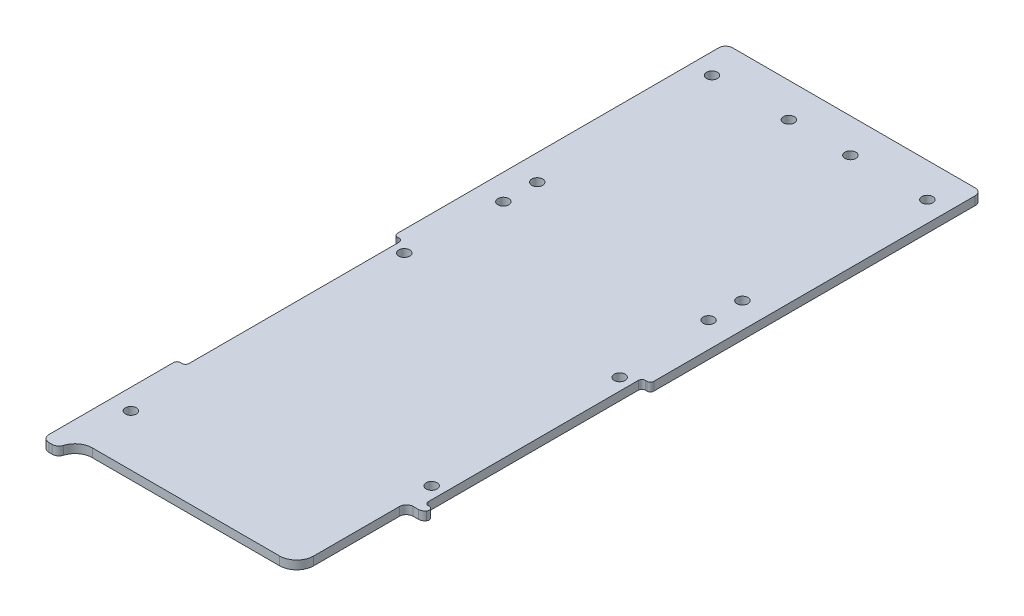
from build123d import *

# Parameters (mm, degrees)
SKETCH1_R               = 2.032
BOSS_EXTRUDE1_DEPTH     = 3.175
FILLET1_R               = 2.54
FILLET2_R               = 2.54
FILLET3_R               = 6.35
CUT_EXTRUDE1_DEPTH      = 136.673215063
FILLET4_R               = 6.35
FILLET5_R               = 2.54
SKETCH3_R               = 2.032
CUT_EXTRUDE2_DEPTH      = 136.673215063
CUT_EXTRUDE3_DEPTH      = 136.673215063
CUT_EXTRUDE3_DEPTH_BACK = 136.673215063
SKETCH4_W               = 3.175
SKETCH4_H               = 80.645
FILLET6_R               = 1.27


with BuildPart() as part:
    # Sketch1 → Boss-Extrude1 (new body)
    with BuildSketch(Plane(origin=(0, 0, 0), x_dir=(1, 0, 0), z_dir=(0, 1, 0))):
        Polygon((47.625, 127), (-47.625, 127), (-47.625, -127), (-41.275, -127), (-41.275, -120.65), (41.275, -120.65), (41.275, -127), (47.625, -127), align=None)
        with Locations((-39.999684148, -101.6)):
            Circle(SKETCH1_R, mode=Mode.SUBTRACT)
        with Locations((39.999684148, -69.85)):
            Circle(SKETCH1_R, mode=Mode.SUBTRACT)
        with Locations((-39.999684148, 0)):
            Circle(SKETCH1_R, mode=Mode.SUBTRACT)
        with Locations((-39.999684148, 114.3)):
            Circle(SKETCH1_R, mode=Mode.SUBTRACT)
        with Locations((-11.424684148, 114.3)):
            Circle(SKETCH1_R, mode=Mode.SUBTRACT)
        with Locations((39.999684148, 0)):
            Circle(SKETCH1_R, mode=Mode.SUBTRACT)
        with Locations((11.424684148, 114.3)):
            Circle(SKETCH1_R, mode=Mode.SUBTRACT)
        with Locations((39.999684148, 114.3)):
            Circle(SKETCH1_R, mode=Mode.SUBTRACT)
    extrude(amount=BOSS_EXTRUDE1_DEPTH)

    # Fillet1
    fillet1_edges = [part.edges().sort_by_distance(p)[0] for p in [
        (-47.625, 1.5875, -127),
        (47.625, 1.5875, -127),
        (47.625, 1.5875, 127),
        (-47.625, 1.5875, 127),
    ]]
    fillet(fillet1_edges, radius=FILLET1_R)

    # Fillet2
    fillet2_edges = [part.edges().sort_by_distance(p)[0] for p in [
        (41.275, 1.5875, 127),
        (-41.275, 1.5875, 127),
    ]]
    fillet(fillet2_edges, radius=FILLET2_R)

    # Fillet3
    fillet3_edges = [part.edges().sort_by_distance(p)[0] for p in [
        (41.275, 1.5875, 120.65),
        (-41.275, 1.5875, 120.65),
    ]]
    fillet(fillet3_edges, radius=FILLET3_R)

    # Sketch2 → Cut-Extrude1 (cut, through all)
    with BuildSketch(Plane.XZ):
        with BuildLine():
            Line((40.64508, 123.578690235), (40.64508, 79.88808))
            Line((40.64508, 79.88808), (47.625, 79.88808))
            Line((47.625, 79.88808), (47.625, 124.46))
            ThreePointArc((47.625, 124.46), (46.881051224, 126.256051224), (45.085, 127))
            Line((45.085, 127), (43.815, 127))
            ThreePointArc((43.815, 127), (42.297059666, 126.496530663), (41.380880287, 125.185714286))
            ThreePointArc((41.380880287, 125.185714286), (41.069166069, 124.356476684), (40.64508, 123.578690235))
        make_face()
    extrude(amount=-CUT_EXTRUDE1_DEPTH, mode=Mode.SUBTRACT)

    # Fillet4
    fillet4_edges = [part.edges().sort_by_distance(p)[0] for p in [
        (40.64508, 1.5875, 123.578690235),
    ]]
    fillet(fillet4_edges, radius=FILLET4_R)

    # Fillet5
    fillet5_edges = [part.edges().sort_by_distance(p)[0] for p in [
        (47.625, 1.5875, 79.88808),
        (40.64508, 1.5875, 79.88808),
    ]]
    fillet(fillet5_edges, radius=FILLET5_R)

    # Sketch3 → Cut-Extrude2 (cut, through all)
    with BuildSketch(Plane.XZ):
        with Locations((-38.109715407, -34.913768806)):
            Circle(SKETCH3_R)
        with Locations((-38.109715407, -47.490173279)):
            Circle(SKETCH3_R)
        with Locations((38.109715407, -47.490173279)):
            Circle(SKETCH3_R)
        with Locations((38.109715407, -34.913768806)):
            Circle(SKETCH3_R)
    extrude(amount=-CUT_EXTRUDE2_DEPTH, mode=Mode.SUBTRACT)

    # Sketch4 → Cut-Extrude3 (cut, two sides: drawn at the far end of the back side and taken through both)
    with BuildSketch(Plane(origin=(0, 3.175, 0), x_dir=(1, 0, 0), z_dir=(0, 1, 0)).offset(-CUT_EXTRUDE3_DEPTH_BACK)):
        with Locations((-46.0375, -36.5125)):
            Rectangle(SKETCH4_W, SKETCH4_H)
        with Locations((46.0375, -36.5125)):
            Rectangle(SKETCH4_W, SKETCH4_H)
    extrude(amount=CUT_EXTRUDE3_DEPTH + CUT_EXTRUDE3_DEPTH_BACK, mode=Mode.SUBTRACT)

    # Fillet6
    fillet6_edges = [part.edges().sort_by_distance(p)[0] for p in [
        (-44.45, 1.5875, -3.81),
        (-47.625, 1.5875, -3.81),
        (-47.625, 1.5875, 76.835),
        (-44.45, 1.5875, 76.835),
        (44.45, 1.5875, 76.835),
        (47.625, 1.5875, 76.835),
        (44.45, 1.5875, -3.81),
        (47.625, 1.5875, -3.81),
    ]]
    fillet(fillet6_edges, radius=FILLET6_R)


solid = part.part
